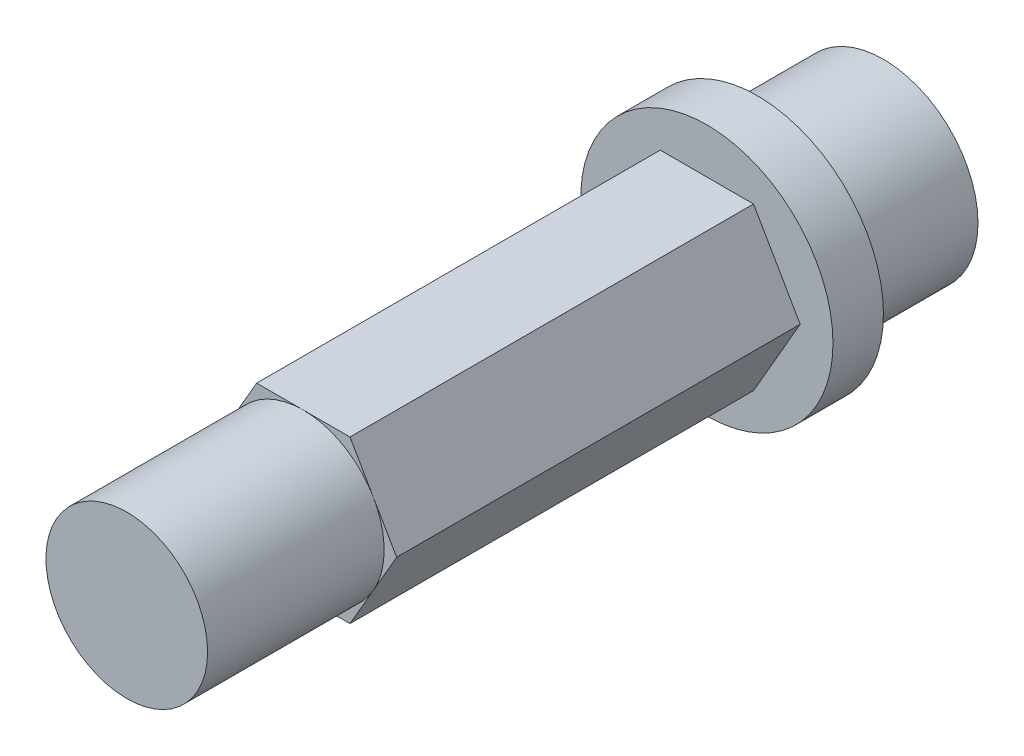
from build123d import *

# Parameters (mm, degrees)
SKETCH1_R           = 3.75
BOSS_EXTRUDE1_DEPTH = 5
SKETCH2_R           = 5
BOSS_EXTRUDE2_DEPTH = 2
BOSS_EXTRUDE3_DEPTH = 16
SKETCH4_R           = 3.204293994
BOSS_EXTRUDE4_DEPTH = 7


with BuildPart() as part:
    # Sketch1 → Boss-Extrude1 (new body)
    with BuildSketch(Plane.XY):
        Circle(SKETCH1_R)
    extrude(amount=BOSS_EXTRUDE1_DEPTH)

    # Sketch2 → Boss-Extrude2 (add)
    with BuildSketch(Plane.XY.offset(5)):
        Circle(SKETCH2_R)
    extrude(amount=BOSS_EXTRUDE2_DEPTH)

    # Sketch3 → Boss-Extrude3 (add)
    with BuildSketch(Plane.XY.offset(7)):
        Polygon((3.7, 0), (1.85, 3.204293994), (-1.85, 3.204293994), (-3.7, 0), (-1.85, -3.204293994), (1.85, -3.204293994), align=None)
    extrude(amount=BOSS_EXTRUDE3_DEPTH)

    # Sketch4 → Boss-Extrude4 (add)
    with BuildSketch(Plane.XY.offset(23)):
        Circle(SKETCH4_R)
    extrude(amount=BOSS_EXTRUDE4_DEPTH)


solid = part.part
